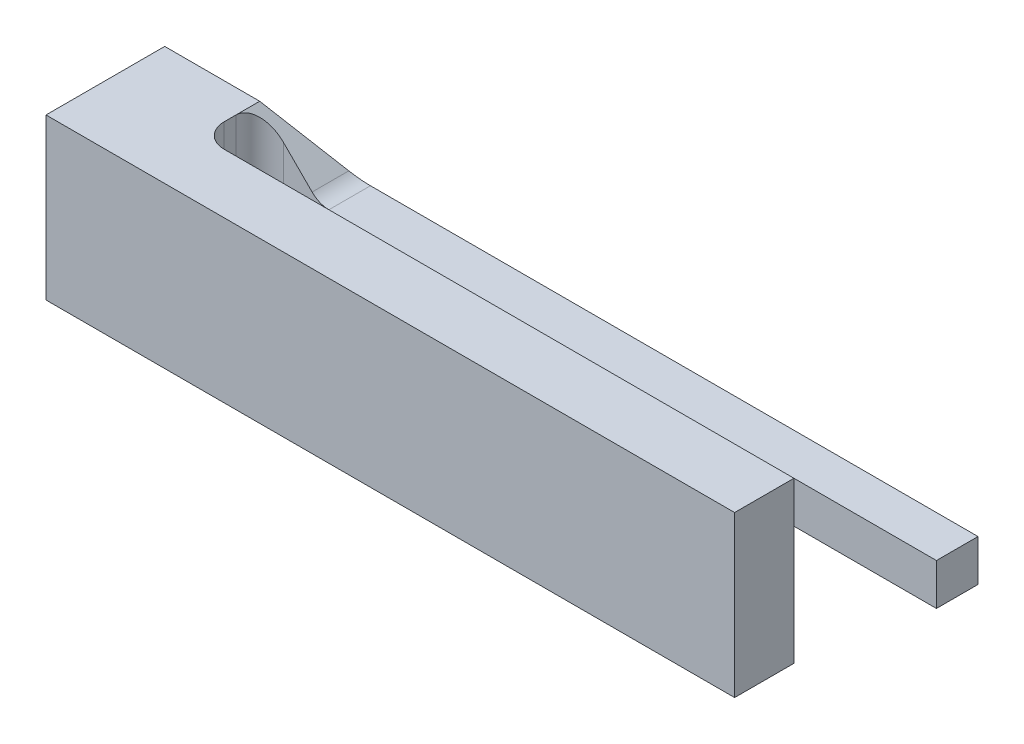
from build123d import *

# Parameters (mm, degrees)
SKETCH_1_W      = 60
SKETCH_1_H      = 3.5
EXTRUDE_1_DEPTH = 3.5
SKETCH_2_W      = 3
SKETCH_2_H      = 5
SKETCH_2_H_2    = 3.5
EXTRUDE_2_DEPTH = 10
EXTRUDE_3_DEPTH = 3
SKETCH_4_W      = 5
SKETCH_4_H      = 5.5
SKETCH_4_H_2    = 4
EXTRUDE_4_DEPTH = 50
CHAMFER_1_SIZE  = 5
FILLET_1_R      = 2
EXTRUDE_5_DEPTH = 5


# Some blends are built 0.0001 mm under size
with BuildPart() as part:
    # 草图1 → 凸台-拉伸1 (new body)
    with BuildSketch(Plane.XY):
        with Locations((15.433843148, 11.499032355)):
            Rectangle(SKETCH_1_W, SKETCH_1_H)
    extrude(amount=EXTRUDE_1_DEPTH)

    # 草图2 → 凸台-拉伸2 (add)
    with BuildSketch(Plane.XY.offset(3.5)):
        with Locations((-13.066156852, 15.749032355)):
            Rectangle(SKETCH_2_W, SKETCH_2_H)
        with Locations((-13.066156852, 11.499032355)):
            Rectangle(SKETCH_2_W, SKETCH_2_H_2)
        with Locations((-13.066156852, 7.249032355)):
            Rectangle(SKETCH_2_W, SKETCH_2_H)
    extrude(amount=EXTRUDE_2_DEPTH)

    # 草图3 → 凸台-拉伸3 (add)
    with BuildSketch(Plane.ZY.offset(14.566156852)):
        Polygon((0, 9.749032355), (3.5, 4.749032355), (3.5, 9.749032355), align=None)
        Polygon((3.5, 18.249032355), (0, 13.249032355), (3.5, 13.249032355), align=None)
    extrude(amount=-EXTRUDE_3_DEPTH)

    # 草图4 → 凸台-拉伸4 (add)
    with BuildSketch(Plane(origin=(-11.566156852, 0, 0), x_dir=(0, 0, -1), z_dir=(1, 0, 0))):
        with Locations((-11, 11.499032355)):
            Rectangle(SKETCH_4_W, SKETCH_4_H)
        with Locations((-11, 6.749032355)):
            Rectangle(SKETCH_4_W, SKETCH_4_H_2)
        with Locations((-11, 16.249032355)):
            Rectangle(SKETCH_4_W, SKETCH_4_H_2)
    extrude(amount=EXTRUDE_4_DEPTH)

    # 倒角1
    chamfer_1_edges = [part.edges().sort_by_distance(p)[0] for p in [
        (-11.566156852, 9.749032355, 1.75),
        (-11.566156852, 13.249032355, 1.75),
    ]]
    chamfer(chamfer_1_edges, length=CHAMFER_1_SIZE - 0.0001)  # a hair under: the kernel refuses the full size

    # 圆角1
    # the kernel refuses this fillet: 2 mm, written as the material it adds along each edge
    with BuildSketch(Plane(origin=(-11.566156852, 23.248932355, 3.5), x_dir=(1, 0, 0), z_dir=(0, -1, 0))) as fillet_1_piece_1_section:
        with BuildLine():
            CenterArc((FILLET_1_R, FILLET_1_R), FILLET_1_R, 180, 90)
            Line((0, FILLET_1_R), (0, 0))
            Line((0, 0), (FILLET_1_R, 0))
        make_face()
    fillet_1_piece_1 = extrude(amount=23.4998, mode=Mode.PRIVATE)
    fillet_1_piece_1 = split(fillet_1_piece_1, bisect_by=Plane(origin=(-7.979513836, 8.335775371, 3.970107375), z_dir=(-0.7071067811865476, 0.7071067811865476, 0)), keep=Keep.TOP, mode=Mode.PRIVATE)
    fillet_1_piece_1 = split(fillet_1_piece_1, bisect_by=Plane(origin=(-7.979513836, 14.662289339, 3.970107375), z_dir=(-0.7071067811865475, -0.7071067811865477, 0)), keep=Keep.TOP, mode=Mode.PRIVATE)
    fillet_1_piece_1 = split(fillet_1_piece_1, bisect_by=Plane(origin=(-11.14277082, 4.749032355, 3.970107375), z_dir=(0, 1, 0)), keep=Keep.TOP, mode=Mode.PRIVATE)
    fillet_1_piece_1 = split(fillet_1_piece_1, bisect_by=Plane(origin=(-11.14277082, 18.249032355, 3.970107375), z_dir=(0, -1, 0)), keep=Keep.TOP, mode=Mode.PRIVATE)
    fillet_1_piece_1 = split(fillet_1_piece_1, bisect_by=Plane(origin=(-11.14277082, 13.939686827, 0.48345813), z_dir=(0, -0.5734623443633282, 0.8192319205190406)), keep=Keep.TOP, mode=Mode.PRIVATE)
    add(fillet_1_piece_1)
    with BuildSketch(Plane(origin=(-11.566156852, 18.249032355, 8.5), x_dir=(0, 0, -1), z_dir=(0, -1, 0))) as fillet_1_piece_2:
        with BuildLine():
            CenterArc((FILLET_1_R, FILLET_1_R), FILLET_1_R, 180, 90)
            Line((0, FILLET_1_R), (0, 0))
            Line((0, 0), (FILLET_1_R, 0))
        make_face()
    extrude(amount=13.5)
    with BuildSketch(Plane(origin=(-6.566256852, 9.749032355, 3.5), x_dir=(-0.7071067811865475, -0.7071067811865475, 0), z_dir=(0, 0, -1))) as fillet_1_piece_3_section:
        with BuildLine():
            CenterArc((FILLET_1_R * 0.414213562373, -FILLET_1_R), FILLET_1_R, 90, 45)
            Line((-FILLET_1_R * 0.292893218813, -FILLET_1_R * 0.292893218813), (0, 0))
            Line((0, 0), (FILLET_1_R * 0.414213562373, 0))
        make_face()
    fillet_1_piece_3 = extrude(amount=3.5, mode=Mode.PRIVATE)
    fillet_1_piece_3 = split(fillet_1_piece_3, bisect_by=Plane(origin=(-6.5069765, 8.826534018, 0.645748836), z_dir=(0, 0.5734623443633283, 0.8192319205190405)), keep=Keep.TOP, mode=Mode.PRIVATE)
    add(fillet_1_piece_3)
    with BuildSketch(Plane(origin=(-6.566256852, 13.249032355, 0), x_dir=(1, 0, 0), z_dir=(0, 0, 1))) as fillet_1_piece_4_section:
        with BuildLine():
            CenterArc((FILLET_1_R * 0.414213562373, FILLET_1_R), FILLET_1_R, 225, 45)
            Line((-FILLET_1_R * 0.292893218813, FILLET_1_R * 0.292893218813), (0, 0))
            Line((0, 0), (FILLET_1_R * 0.414213562373, 0))
        make_face()
    fillet_1_piece_4 = extrude(amount=3.5, mode=Mode.PRIVATE)
    fillet_1_piece_4 = split(fillet_1_piece_4, bisect_by=Plane(origin=(-6.5069765, 14.171530692, 0.645748836), z_dir=(0, -0.5734623443633282, 0.8192319205190406)), keep=Keep.TOP, mode=Mode.PRIVATE)
    add(fillet_1_piece_4)

    # 草图5 → 凸台-拉伸5 (add)
    with BuildSketch(Plane.ZY.offset(14.566156852)):
        Polygon((3.5, 18.249032355), (0, 13.249032355), (0, 9.749032355), (3.5, 4.749032355), (13.5, 4.749032355), (13.5, 18.249032355), align=None)
    extrude(amount=EXTRUDE_5_DEPTH)


solid = part.part
